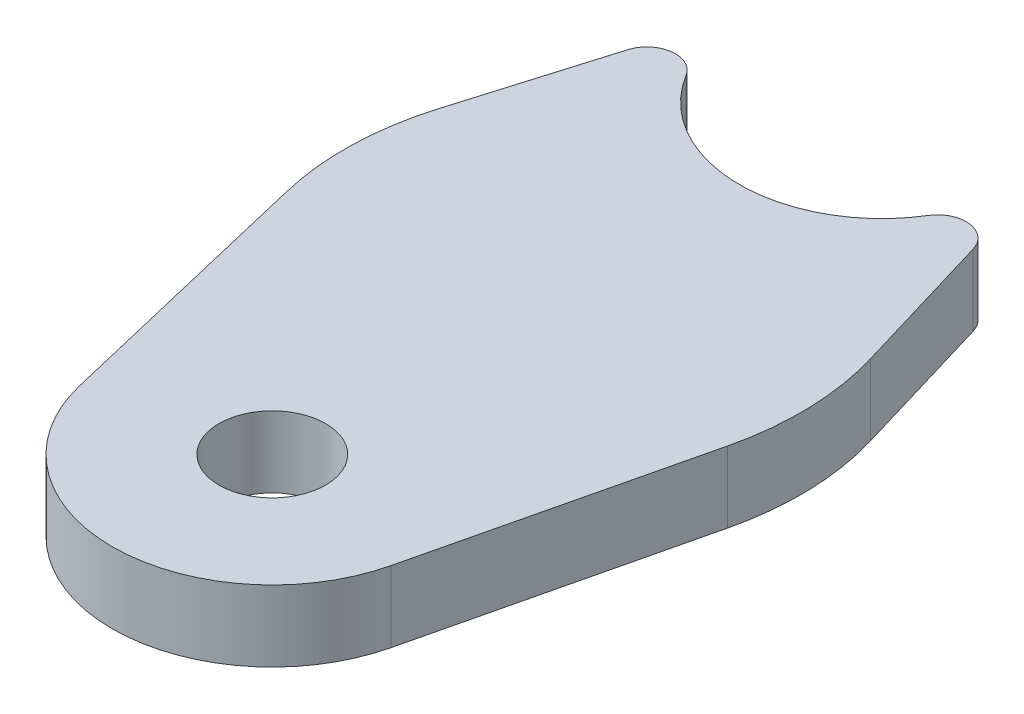
from build123d import *

# Parameters (mm, degrees)
SKETCH13_R          = 4.7625
BOSS_EXTRUDE1_DEPTH = 6.35
FILLET1_START       = -1
FILLET1_DEPTH       = 8
FILLET2_R           = 25.4


with BuildPart() as part:
    # Sketch13 → Boss-Extrude1 (new body)
    with BuildSketch(Plane(origin=(0, 0, 0), x_dir=(1, 0, 0), z_dir=(0, 1, 0))):
        with BuildLine():
            Line((12.169749373, 58.041291034), (21.253749792, 27.59863924))
            Line((21.253749792, 27.59863924), (13.899399026, -3.307470782))
            ThreePointArc((13.899399026, -3.307470782), (0, -14.2875), (-13.899399026, -3.307470782))
            Line((-13.899399026, -3.307470782), (-21.253749792, 27.59863924))
            Line((-21.253749792, 27.59863924), (-12.169749373, 58.041291034))
            ThreePointArc((-12.169749373, 58.041291034), (0, 41.709872551), (12.169749373, 58.041291034))
        make_face()
        with Locations(Location((0, 0, 0), (0, 0, 270))):
            Circle(SKETCH13_R, mode=Mode.SUBTRACT)
    extrude(amount=BOSS_EXTRUDE1_DEPTH)

    # Fillet1: read off the stored shape, not the designer's step
    # Fillet1 outline → Fillet1 (cut)
    with BuildSketch(Plane(origin=(0, 0, 0), x_dir=(1, 0, 0), z_dir=(0, 1, 0)).offset(FILLET1_START)):
        with BuildLine():
            ThreePointArc((12.169749373, 58.041291034), (12.591930806, 52.756609539), (10.819865776, 47.760022584))
            ThreePointArc((10.819865776, 47.760022584), (13.314491534, 48.948438752), (15.417788806, 47.156336287))
            Line((15.417788806, 47.156336287), (12.169749373, 58.041291034))
        make_face()
        with BuildLine():
            ThreePointArc((-15.417788806, 47.156336287), (-13.314491534, 48.948438752), (-10.819865776, 47.760022584))
            ThreePointArc((-10.819865776, 47.760022584), (-12.591930806, 52.756609539), (-12.169749373, 58.041291034))
            Line((-12.169749373, 58.041291034), (-15.417788806, 47.156336287))
        make_face()
    extrude(amount=FILLET1_DEPTH, mode=Mode.SUBTRACT)

    # Fillet2
    fillet2_edges = [part.edges().sort_by_distance(p)[0] for p in [
        (21.253749792, 3.175, -27.59863924),
        (-21.253749792, 3.175, -27.59863924),
    ]]
    fillet(fillet2_edges, radius=FILLET2_R)


solid = part.part
